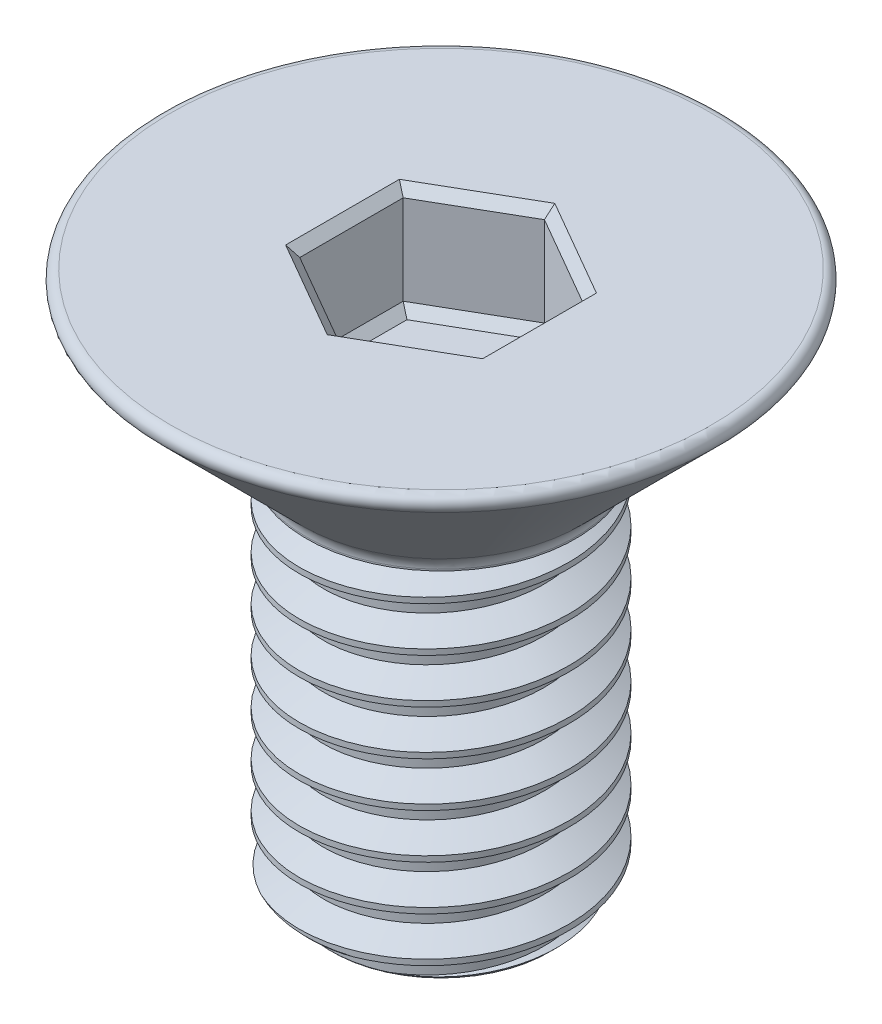
from build123d import *

# Parameters (mm, degrees)
SKETCH1_R           = 1.5
BOSS_EXTRUDE1_DEPTH = 4.14
THREAD1_PITCH       = 0.5
SKETCH5_R           = 1.5
BOSS_EXTRUDE2_DEPTH = 0.1
SKETCH6_R           = 1.5
BOSS_EXTRUDE3_DEPTH = 1.76
BOSS_EXTRUDE3_DRAFT = -45
FILLET1_R           = 0.1
FILLET2_R           = 0.2
CUT_EXTRUDE1_DEPTH  = 1.1
CHAMFER1_SIZE       = 0.1
CUT_EXTRUDE2_DEPTH  = 0.1
CUT_EXTRUDE2_DRAFT  = -45


with BuildPart() as part:
    # Sketch1 → Boss-Extrude1 (new body)
    with BuildSketch(Plane(origin=(0, 0, 0), x_dir=(1, 0, 0), z_dir=(0, 1, 0))):
        with Locations(Location((0, 0, 0), (0, 0, 270))):
            Circle(SKETCH1_R)
    extrude(amount=BOSS_EXTRUDE1_DEPTH)

    # Thread1: the profile of Thread Profile1 profile screwed along a right-hand helix of 10.28 turns, 6 arcs to a turn; built about Z, then put on its axis
    thread1_z = Axis((0, 0, 0), (0, 0, 1))
    thread1_corners = [(1.5003, 0, -0.000173205), (1.5003, 0, 0.437673204), (1.229367063, 0, 0.281249999), (1.229367063, 0, 0.156249999)]
    with BuildLine(mode=Mode.PRIVATE) as thread1_profile:
        Line(thread1_corners[0], thread1_corners[1])
        Line(thread1_corners[1], thread1_corners[2])
        Line(thread1_corners[2], thread1_corners[3])
        Line(thread1_corners[3], thread1_corners[0])
    thread1_cap = Face(thread1_profile.wire())
    thread1_turn_angles = [0, 30, 60, 90, 120, 150, 180, 210, 240, 270, 300, 330, 360]
    thread1_turn_weights = [1, 0.8660254037844387, 1, 0.8660254037844387, 1, 0.8660254037844387, 1, 0.8660254037844387, 1, 0.8660254037844387, 1, 0.8660254037844387, 1]
    thread1_turn_rails = [Edge.make_bspline([Vector(p[0], p[1], 0).rotate(thread1_z, thread1_turn_angles[k]) / thread1_turn_weights[k] + Vector(0, 0, p[2] + THREAD1_PITCH * thread1_turn_angles[k] / 360) for k in range(13)], [0, 0, 0, 1, 1, 2, 2, 3, 3, 4, 4, 5, 5, 6, 6, 6], 2, thread1_turn_weights) for p in thread1_corners]
    thread1_turn_sides = [Face.make_surface_from_curves(thread1_turn_rails[p[0]], thread1_turn_rails[p[1]]) for p in [(0, 1), (1, 2), (2, 3), (3, 0)]]
    thread1_last_angles = [3600, 3630, 3660, 3680.4, 3700.8]
    thread1_last_weights = [1, 0.8660254037844387, 1, 0.9372819894918909, 1]
    thread1_last_rails = [Edge.make_bspline([Vector(p[0], p[1], 0).rotate(thread1_z, thread1_last_angles[k]) / thread1_last_weights[k] + Vector(0, 0, p[2] + THREAD1_PITCH * thread1_last_angles[k] / 360) for k in range(5)], [0, 0, 0, 1, 1, 2, 2, 2], 2, thread1_last_weights) for p in thread1_corners]
    thread1_last_sides = [Face.make_surface_from_curves(thread1_last_rails[p[0]], thread1_last_rails[p[1]]) for p in [(0, 1), (1, 2), (2, 3), (3, 0)]]
    thread1 = Plane(origin=(0, 5.14, 0), x_dir=(-1, 0, 0), z_dir=(0, -1, 0)) * Solid(Shell([*[p.moved(Location((0, 0, THREAD1_PITCH * i))) for i in range(10) for p in thread1_turn_sides], *thread1_last_sides, thread1_cap, thread1_cap.rotate(thread1_z, 3700.8).moved(Location((0, 0, THREAD1_PITCH * 3700.8 / 360)))]))
    add(thread1, mode=Mode.SUBTRACT)

    # Sketch5 → Boss-Extrude2 (add)
    with BuildSketch(Plane(origin=(0, 4.14, 0), x_dir=(1, 0, 0), z_dir=(0, 1, 0))):
        with Locations(Location((0, 0, 0), (0, 0, 79.630240194))):
            Circle(SKETCH5_R)
    extrude(amount=BOSS_EXTRUDE2_DEPTH)


with BuildPart() as boss_extrude3_tool:
    # Sketch6 → Boss-Extrude3 (with draft: the straight prism first)
    with BuildSketch(Plane(origin=(0, 4.24, 0), x_dir=(1, 0, 0), z_dir=(0, 1, 0))):
        with Locations(Location((0, 0, 0), (0, 0, 79.630240194))):
            Circle(SKETCH6_R)
    extrude(amount=BOSS_EXTRUDE3_DEPTH)
    # Boss-Extrude3: the draft: its side faces are tilted about the plane it starts from
    boss_extrude3_sides = [boss_extrude3_tool.faces().sort_by_distance(p)[0] for p in [
        (-0.27, 5.12, 1.475499915),
    ]]
    draft(boss_extrude3_sides, Plane(origin=(0, 4.24, 0), x_dir=(1, 0, 0), z_dir=(0, 1, 0)), BOSS_EXTRUDE3_DRAFT)


with BuildPart() as part_1:
    add(part.part)

    # Boss-Extrude3: add boss_extrude3_tool
    add(boss_extrude3_tool.part)

    # Sketch7 → Cut-Revolve1 (revolve, cut)
    with BuildSketch(Plane.XY, mode=Mode.PRIVATE) as cut_revolve1_sk:
        Polygon((1.51, 0), (1.51, 0.3), (1.21, 0), align=None)
    revolve(cut_revolve1_sk.sketch.rotate(Axis((0, 0, 0), (0, 1, 0)), 135.522486844), axis=Axis((0, 0, 0), (0, 1, 0)), mode=Mode.SUBTRACT)

    # Fillet1
    fillet1_edges = [part_1.edges().sort_by_distance(p)[0] for p in [
        (-0.5868, 6, 3.206753149),
    ]]
    fillet(fillet1_edges, radius=FILLET1_R)

    # Fillet2
    fillet2_edges = [part_1.edges().sort_by_distance(p)[0] for p in [
        (-0.27, 4.24, 1.475499915),
    ]]
    fillet(fillet2_edges, radius=FILLET2_R)

    # Sketch8 → Cut-Extrude1 (cut)
    with BuildSketch(Plane(origin=(0, 6, 0), x_dir=(1, 0, 0), z_dir=(0, 1, 0))):
        Polygon((0, 1.154700538), (-1, 0.577350269), (-1, -0.577350269), (0, -1.154700538), (1, -0.577350269), (1, 0.577350269), align=None)
    extrude(amount=-CUT_EXTRUDE1_DEPTH, mode=Mode.SUBTRACT)

    # Chamfer1
    chamfer1_edges = [part_1.edges().sort_by_distance(p)[0] for p in [
        (0.5, 6, -0.866025404),
        (-0.5, 6, -0.866025404),
        (-1, 6, 0),
        (-0.5, 6, 0.866025404),
        (0.5, 6, 0.866025404),
        (1, 6, 0),
    ]]
    chamfer(chamfer1_edges, length=CHAMFER1_SIZE)


with BuildPart() as cut_extrude2_tool:
    # Sketch9 → Cut-Extrude2 (with draft: the straight prism first)
    with BuildSketch(Plane(origin=(0, 4.9, 0), x_dir=(1, 0, 0), z_dir=(0, 1, 0))):
        Polygon((0, 1.154700538), (-1, 0.577350269), (-1, -0.577350269), (0, -1.154700538), (1, -0.577350269), (1, 0.577350269), align=None)
    extrude(amount=-CUT_EXTRUDE2_DEPTH)
    # Cut-Extrude2: the draft: its side faces are tilted about the plane it starts from
    cut_extrude2_sides = [cut_extrude2_tool.faces().sort_by_distance(p)[0] for p in [
        (-0.5, 4.85, -0.866025404),
        (-1, 4.85, 0),
        (-0.5, 4.85, 0.866025404),
        (0.5, 4.85, 0.866025404),
        (1, 4.85, 0),
        (0.5, 4.85, -0.866025404),
    ]]
    draft(cut_extrude2_sides, Plane(origin=(0, 4.9, 0), x_dir=(1, 0, 0), z_dir=(0, 1, 0)), CUT_EXTRUDE2_DRAFT)


with BuildPart() as part_2:
    add(part_1.part)

    # Cut-Extrude2: cut by cut_extrude2_tool
    add(cut_extrude2_tool.part, mode=Mode.SUBTRACT)


solid = part_2.part
